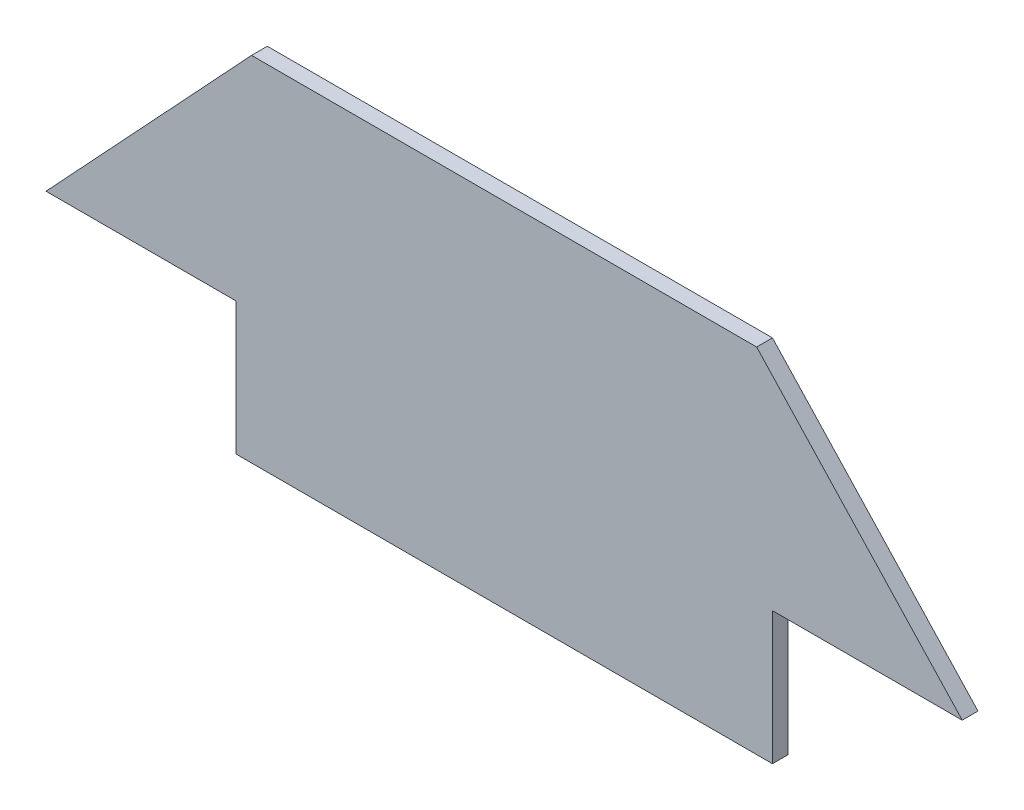
from build123d import *

# Parameters (mm, degrees)
EXTRUDE_1_DEPTH = 5


with BuildPart() as part:
    # 草图1 → 凸台-拉伸1 (new body)
    with BuildSketch(Plane.XY):
        Polygon((-80, 0), (-145.109322536, -69.821200219), (-85, -69.821200219), (-85, -111.821200219), (85, -111.821200219), (85, -69.821200219), (145.109322536, -69.821200219), (80, 0), align=None)
    extrude(amount=EXTRUDE_1_DEPTH)


solid = part.part
